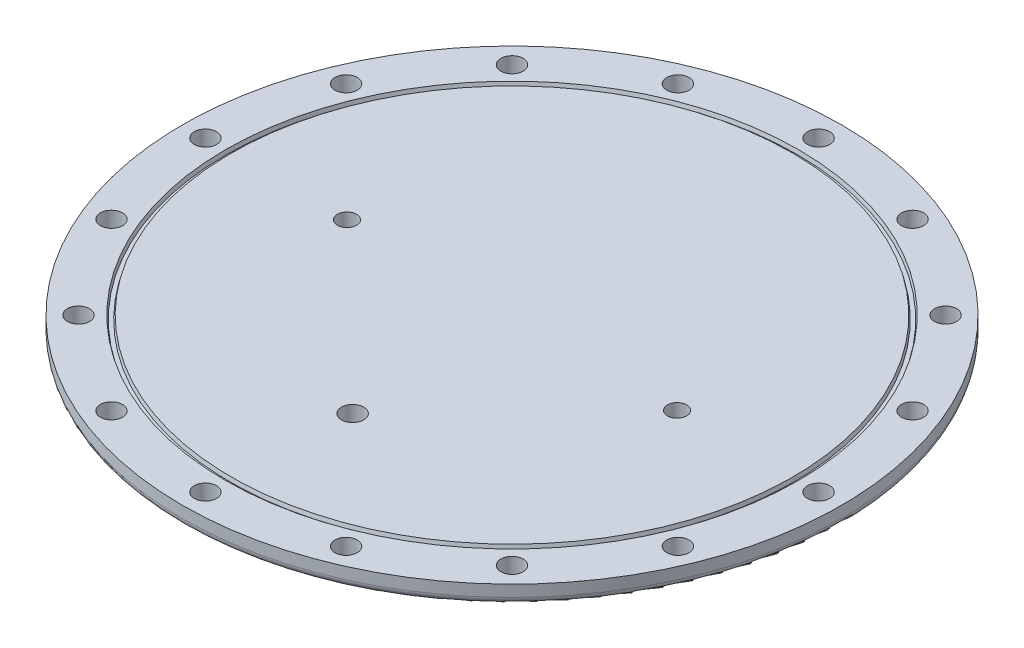
from build123d import *

# Parameters (mm, degrees)
SKETCH1_R           = 86
BOSS_EXTRUDE1_DEPTH = 5
CUT_EXTRUDE1_REACH  = 123.725
SKETCH2_R           = 2.9
CUT_EXTRUDE2_REACH  = 123.725
SKETCH5_R           = 2.5
SKETCH5_R_2         = 2.9
FILLET1_R           = 2


with BuildPart() as part:
    # Sketch1 → Boss-Extrude1 (new body)
    with BuildSketch(Plane(origin=(0, 0, 0), x_dir=(1, 0, 0), z_dir=(0, 1, 0))):
        Circle(SKETCH1_R)
    extrude(amount=BOSS_EXTRUDE1_DEPTH)

    # Sketch2 → Cut-Extrude1 (cut, up to next)
    with BuildSketch(Plane(origin=(0, 5, 0), x_dir=(1, 0, 0), z_dir=(0, 1, 0)), mode=Mode.PRIVATE) as cut_extrude1_sk1:
        with Locations((0, 80)):
            Circle(SKETCH2_R)
    cut_extrude1_tool1 = extrude(cut_extrude1_sk1.sketch, amount=-CUT_EXTRUDE1_REACH, mode=Mode.PRIVATE) & part.part
    # Sketch2 → Cut-Extrude1 (cut, up to next)
    with BuildSketch(Plane(origin=(0, 5, 0), x_dir=(1, 0, 0), z_dir=(0, 1, 0)), mode=Mode.PRIVATE) as cut_extrude1_sk2:
        with Locations((30.614674589, 73.910362601)):
            Circle(SKETCH2_R)
    cut_extrude1_tool2 = extrude(cut_extrude1_sk2.sketch, amount=-CUT_EXTRUDE1_REACH, mode=Mode.PRIVATE) & part.part
    # Sketch2 → Cut-Extrude1 (cut, up to next)
    with BuildSketch(Plane(origin=(0, 5, 0), x_dir=(1, 0, 0), z_dir=(0, 1, 0)), mode=Mode.PRIVATE) as cut_extrude1_sk3:
        with Locations((56.568542495, 56.568542495)):
            Circle(SKETCH2_R)
    cut_extrude1_tool3 = extrude(cut_extrude1_sk3.sketch, amount=-CUT_EXTRUDE1_REACH, mode=Mode.PRIVATE) & part.part
    # Sketch2 → Cut-Extrude1 (cut, up to next)
    with BuildSketch(Plane(origin=(0, 5, 0), x_dir=(1, 0, 0), z_dir=(0, 1, 0)), mode=Mode.PRIVATE) as cut_extrude1_sk4:
        with Locations((73.910362601, 30.614674589)):
            Circle(SKETCH2_R)
    cut_extrude1_tool4 = extrude(cut_extrude1_sk4.sketch, amount=-CUT_EXTRUDE1_REACH, mode=Mode.PRIVATE) & part.part
    # Sketch2 → Cut-Extrude1 (cut, up to next)
    with BuildSketch(Plane(origin=(0, 5, 0), x_dir=(1, 0, 0), z_dir=(0, 1, 0)), mode=Mode.PRIVATE) as cut_extrude1_sk5:
        with Locations((80, 0)):
            Circle(SKETCH2_R)
    cut_extrude1_tool5 = extrude(cut_extrude1_sk5.sketch, amount=-CUT_EXTRUDE1_REACH, mode=Mode.PRIVATE) & part.part
    # Sketch2 → Cut-Extrude1 (cut, up to next)
    with BuildSketch(Plane(origin=(0, 5, 0), x_dir=(1, 0, 0), z_dir=(0, 1, 0)), mode=Mode.PRIVATE) as cut_extrude1_sk6:
        with Locations((73.910362601, -30.614674589)):
            Circle(SKETCH2_R)
    cut_extrude1_tool6 = extrude(cut_extrude1_sk6.sketch, amount=-CUT_EXTRUDE1_REACH, mode=Mode.PRIVATE) & part.part
    # Sketch2 → Cut-Extrude1 (cut, up to next)
    with BuildSketch(Plane(origin=(0, 5, 0), x_dir=(1, 0, 0), z_dir=(0, 1, 0)), mode=Mode.PRIVATE) as cut_extrude1_sk7:
        with Locations((56.568542495, -56.568542495)):
            Circle(SKETCH2_R)
    cut_extrude1_tool7 = extrude(cut_extrude1_sk7.sketch, amount=-CUT_EXTRUDE1_REACH, mode=Mode.PRIVATE) & part.part
    # Sketch2 → Cut-Extrude1 (cut, up to next)
    with BuildSketch(Plane(origin=(0, 5, 0), x_dir=(1, 0, 0), z_dir=(0, 1, 0)), mode=Mode.PRIVATE) as cut_extrude1_sk8:
        with Locations((30.614674589, -73.910362601)):
            Circle(SKETCH2_R)
    cut_extrude1_tool8 = extrude(cut_extrude1_sk8.sketch, amount=-CUT_EXTRUDE1_REACH, mode=Mode.PRIVATE) & part.part
    # Sketch2 → Cut-Extrude1 (cut, up to next)
    with BuildSketch(Plane(origin=(0, 5, 0), x_dir=(1, 0, 0), z_dir=(0, 1, 0)), mode=Mode.PRIVATE) as cut_extrude1_sk9:
        with Locations((0, -80)):
            Circle(SKETCH2_R)
    cut_extrude1_tool9 = extrude(cut_extrude1_sk9.sketch, amount=-CUT_EXTRUDE1_REACH, mode=Mode.PRIVATE) & part.part
    # Sketch2 → Cut-Extrude1 (cut, up to next)
    with BuildSketch(Plane(origin=(0, 5, 0), x_dir=(1, 0, 0), z_dir=(0, 1, 0)), mode=Mode.PRIVATE) as cut_extrude1_sk10:
        with Locations((-30.614674589, -73.910362601)):
            Circle(SKETCH2_R)
    cut_extrude1_tool10 = extrude(cut_extrude1_sk10.sketch, amount=-CUT_EXTRUDE1_REACH, mode=Mode.PRIVATE) & part.part
    # Sketch2 → Cut-Extrude1 (cut, up to next)
    with BuildSketch(Plane(origin=(0, 5, 0), x_dir=(1, 0, 0), z_dir=(0, 1, 0)), mode=Mode.PRIVATE) as cut_extrude1_sk11:
        with Locations((-56.568542495, -56.568542495)):
            Circle(SKETCH2_R)
    cut_extrude1_tool11 = extrude(cut_extrude1_sk11.sketch, amount=-CUT_EXTRUDE1_REACH, mode=Mode.PRIVATE) & part.part
    # Sketch2 → Cut-Extrude1 (cut, up to next)
    with BuildSketch(Plane(origin=(0, 5, 0), x_dir=(1, 0, 0), z_dir=(0, 1, 0)), mode=Mode.PRIVATE) as cut_extrude1_sk12:
        with Locations((-73.910362601, -30.614674589)):
            Circle(SKETCH2_R)
    cut_extrude1_tool12 = extrude(cut_extrude1_sk12.sketch, amount=-CUT_EXTRUDE1_REACH, mode=Mode.PRIVATE) & part.part
    # Sketch2 → Cut-Extrude1 (cut, up to next)
    with BuildSketch(Plane(origin=(0, 5, 0), x_dir=(1, 0, 0), z_dir=(0, 1, 0)), mode=Mode.PRIVATE) as cut_extrude1_sk13:
        with Locations((-80, 0)):
            Circle(SKETCH2_R)
    cut_extrude1_tool13 = extrude(cut_extrude1_sk13.sketch, amount=-CUT_EXTRUDE1_REACH, mode=Mode.PRIVATE) & part.part
    # Sketch2 → Cut-Extrude1 (cut, up to next)
    with BuildSketch(Plane(origin=(0, 5, 0), x_dir=(1, 0, 0), z_dir=(0, 1, 0)), mode=Mode.PRIVATE) as cut_extrude1_sk14:
        with Locations((-73.910362601, 30.614674589)):
            Circle(SKETCH2_R)
    cut_extrude1_tool14 = extrude(cut_extrude1_sk14.sketch, amount=-CUT_EXTRUDE1_REACH, mode=Mode.PRIVATE) & part.part
    # Sketch2 → Cut-Extrude1 (cut, up to next)
    with BuildSketch(Plane(origin=(0, 5, 0), x_dir=(1, 0, 0), z_dir=(0, 1, 0)), mode=Mode.PRIVATE) as cut_extrude1_sk15:
        with Locations((-56.568542495, 56.568542495)):
            Circle(SKETCH2_R)
    cut_extrude1_tool15 = extrude(cut_extrude1_sk15.sketch, amount=-CUT_EXTRUDE1_REACH, mode=Mode.PRIVATE) & part.part
    # Sketch2 → Cut-Extrude1 (cut, up to next)
    with BuildSketch(Plane(origin=(0, 5, 0), x_dir=(1, 0, 0), z_dir=(0, 1, 0)), mode=Mode.PRIVATE) as cut_extrude1_sk16:
        with Locations((-30.614674589, 73.910362601)):
            Circle(SKETCH2_R)
    cut_extrude1_tool16 = extrude(cut_extrude1_sk16.sketch, amount=-CUT_EXTRUDE1_REACH, mode=Mode.PRIVATE) & part.part
    add(cut_extrude1_tool1.solids().sort_by_distance((0, 5, -80))[0], mode=Mode.SUBTRACT)
    add(cut_extrude1_tool2.solids().sort_by_distance((30.614675, 5, -73.910363))[0], mode=Mode.SUBTRACT)
    add(cut_extrude1_tool3.solids().sort_by_distance((56.568542, 5, -56.568542))[0], mode=Mode.SUBTRACT)
    add(cut_extrude1_tool4.solids().sort_by_distance((73.910363, 5, -30.614675))[0], mode=Mode.SUBTRACT)
    add(cut_extrude1_tool5.solids().sort_by_distance((80, 5, 0))[0], mode=Mode.SUBTRACT)
    add(cut_extrude1_tool6.solids().sort_by_distance((73.910363, 5, 30.614675))[0], mode=Mode.SUBTRACT)
    add(cut_extrude1_tool7.solids().sort_by_distance((56.568542, 5, 56.568542))[0], mode=Mode.SUBTRACT)
    add(cut_extrude1_tool8.solids().sort_by_distance((30.614675, 5, 73.910363))[0], mode=Mode.SUBTRACT)
    add(cut_extrude1_tool9.solids().sort_by_distance((0, 5, 80))[0], mode=Mode.SUBTRACT)
    add(cut_extrude1_tool10.solids().sort_by_distance((-30.614675, 5, 73.910363))[0], mode=Mode.SUBTRACT)
    add(cut_extrude1_tool11.solids().sort_by_distance((-56.568542, 5, 56.568542))[0], mode=Mode.SUBTRACT)
    add(cut_extrude1_tool12.solids().sort_by_distance((-73.910363, 5, 30.614675))[0], mode=Mode.SUBTRACT)
    add(cut_extrude1_tool13.solids().sort_by_distance((-80, 5, 0))[0], mode=Mode.SUBTRACT)
    add(cut_extrude1_tool14.solids().sort_by_distance((-73.910363, 5, -30.614675))[0], mode=Mode.SUBTRACT)
    add(cut_extrude1_tool15.solids().sort_by_distance((-56.568542, 5, -56.568542))[0], mode=Mode.SUBTRACT)
    add(cut_extrude1_tool16.solids().sort_by_distance((-30.614675, 5, -73.910363))[0], mode=Mode.SUBTRACT)

    # Sketch5 → Cut-Extrude2 (cut, up to next)
    with BuildSketch(Plane.XZ, mode=Mode.PRIVATE) as cut_extrude2_sk1:
        with Locations((43.064309425, 0)):
            Circle(SKETCH5_R)
    cut_extrude2_tool1 = extrude(cut_extrude2_sk1.sketch, amount=-CUT_EXTRUDE2_REACH, mode=Mode.PRIVATE) & part.part
    # Sketch5 → Cut-Extrude2 (cut, up to next)
    with BuildSketch(Plane.XZ, mode=Mode.PRIVATE) as cut_extrude2_sk2:
        with Locations((-43.064309425, 0)):
            Circle(SKETCH5_R)
    cut_extrude2_tool2 = extrude(cut_extrude2_sk2.sketch, amount=-CUT_EXTRUDE2_REACH, mode=Mode.PRIVATE) & part.part
    # Sketch5 → Cut-Extrude2 (cut, up to next)
    with BuildSketch(Plane.XZ, mode=Mode.PRIVATE) as cut_extrude2_sk3:
        with Locations((1.446676169, 43.040003186)):
            Circle(SKETCH5_R_2)
    cut_extrude2_tool3 = extrude(cut_extrude2_sk3.sketch, amount=-CUT_EXTRUDE2_REACH, mode=Mode.PRIVATE) & part.part
    add(cut_extrude2_tool1.solids().sort_by_distance((43.064309, 0, 0))[0], mode=Mode.SUBTRACT)
    add(cut_extrude2_tool2.solids().sort_by_distance((-43.064309, 0, 0))[0], mode=Mode.SUBTRACT)
    add(cut_extrude2_tool3.solids().sort_by_distance((1.446676, 0, 43.040003))[0], mode=Mode.SUBTRACT)

    # Sketch4 → Cut-Revolve1 (revolve, cut)
    with BuildSketch(Plane.XY):
        Polygon((74, 4), (74.5, 4), (74.767949192, 5), (73.232050808, 5), (73.5, 4), align=None)
    revolve(axis=Axis((0, 0, 0), (0, 1, 0)), mode=Mode.SUBTRACT)

    # Fillet1
    fillet1_edges = [part.edges().sort_by_distance(p)[0] for p in [
        (-86, 0, 0),
    ]]
    fillet(fillet1_edges, radius=FILLET1_R)


solid = part.part
